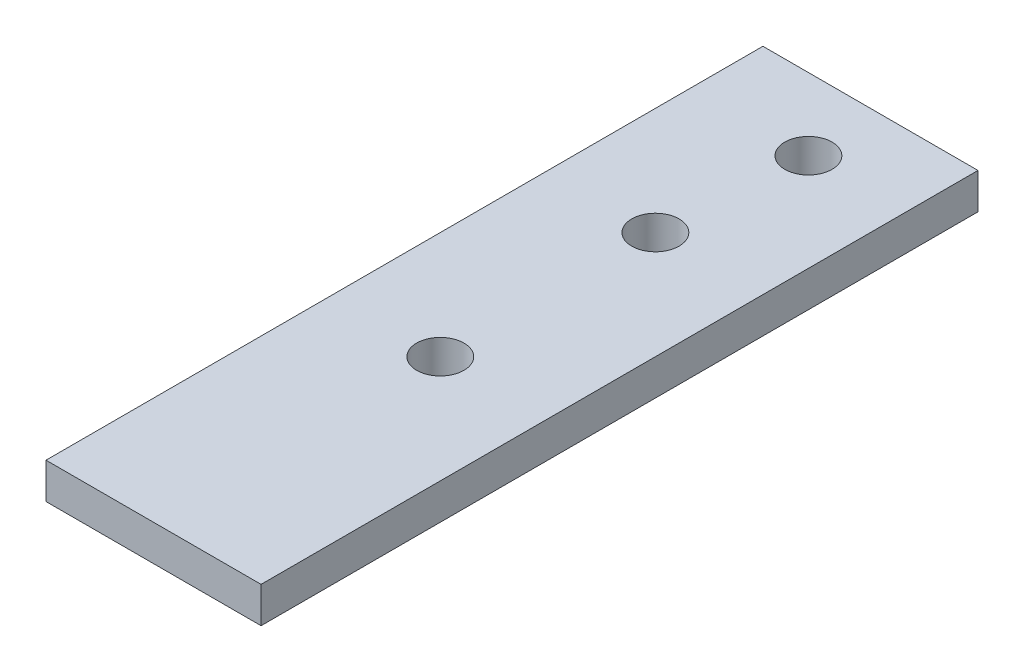
from build123d import *

# Parameters (mm, degrees)
SKETCH1_W           = 38.1
SKETCH1_H           = 88.9
SKETCH1_R           = 4.191
BOSS_EXTRUDE1_DEPTH = 6.35
SKETCH3_W           = 38.1
SKETCH3_H           = 6.35
BOSS_EXTRUDE2_DEPTH = 38.1


with BuildPart() as part:
    # Sketch1 → Boss-Extrude1 (new body)
    with BuildSketch(Plane(origin=(0, 0, 0), x_dir=(1, 0, 0), z_dir=(0, 1, 0))):
        with Locations((19.05, 44.45)):
            Rectangle(SKETCH1_W, SKETCH1_H)
        with Locations((19.05, 12.7)):
            Circle(SKETCH1_R, mode=Mode.SUBTRACT)
        with Locations((19.05, 50.8)):
            Circle(SKETCH1_R, mode=Mode.SUBTRACT)
        with Locations((20.821814433, 76.138126877)):
            Circle(SKETCH1_R, mode=Mode.SUBTRACT)
    extrude(amount=BOSS_EXTRUDE1_DEPTH)

    # Sketch3 → Boss-Extrude2 (add)
    with BuildSketch(Plane.XY):
        with Locations((19.05, 3.175)):
            Rectangle(SKETCH3_W, SKETCH3_H)
    extrude(amount=BOSS_EXTRUDE2_DEPTH)


solid = part.part
